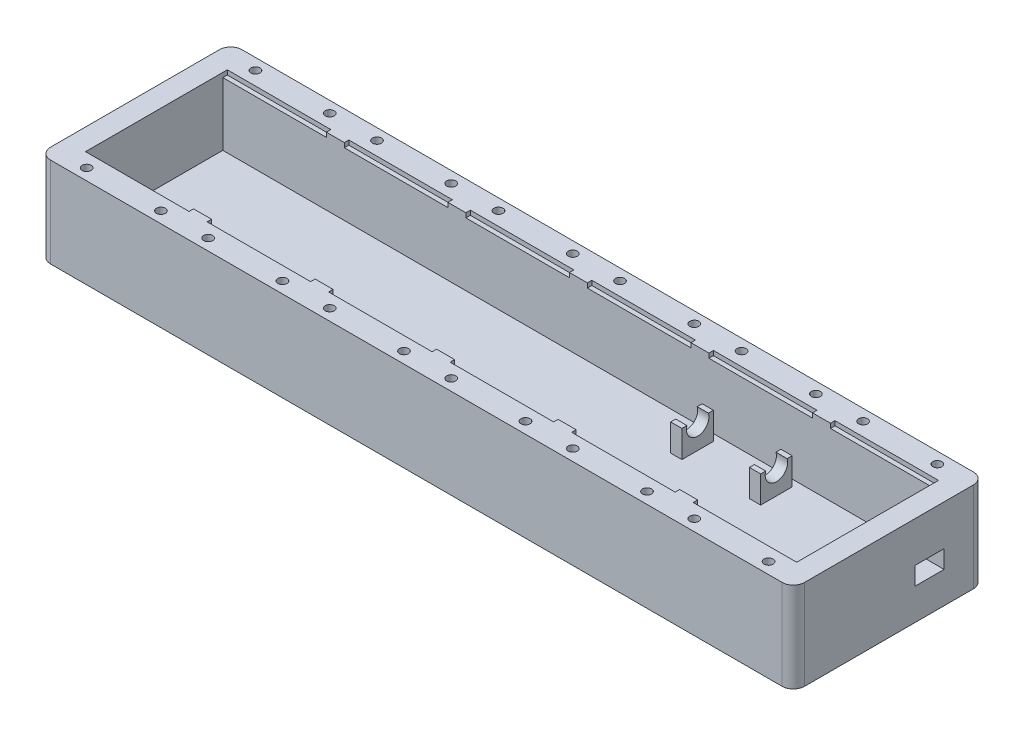
from build123d import *

# Parameters (mm, degrees)
SKIZZE2_W                       = 335
SKIZZE2_H                       = 40
AUFSATZ_LINEAR_AUSTRAGEN1_DEPTH = 85
SKIZZE4_W                       = 316
SKIZZE4_H                       = 59
SCHNITT_LINEAR_AUSTRAGEN1_DEPTH = 30
SKIZZE11_W                      = 46
SKIZZE11_H                      = 2
SCHNITT_LINEAR_AUSTRAGEN4_DEPTH = 2
SKIZZE17_R                      = 2
SCHNITT_LINEAR_AUSTRAGEN6_DEPTH = 4
VERRUNDUNG2_R                   = 5
VERRUNDUNG3_R                   = 5
VERRUNDUNG4_R                   = 5
VERRUNDUNG6_R                   = 5
SKIZZE18_W                      = 13
SKIZZE18_H                      = 8
SCHNITT_LINEAR_AUSTRAGEN7_DEPTH = 10
SKIZZE20_W                      = 5
SKIZZE20_H                      = 14
AUFSATZ_LINEAR_AUSTRAGEN2_DEPTH = 12
SKIZZE21_R                      = 5
SCHNITT_LINEAR_AUSTRAGEN8_DEPTH = 71
SKIZZE22_W                      = 50
SKIZZE22_H                      = 7
AUFSATZ_LINEAR_AUSTRAGEN3_DEPTH = 7


with BuildPart() as part:
    # Skizze2 → Aufsatz-Linear austragen1 (new body)
    with BuildSketch(Plane.XY):
        with Locations((167.5, 20)):
            Rectangle(SKIZZE2_W, SKIZZE2_H)
    extrude(amount=AUFSATZ_LINEAR_AUSTRAGEN1_DEPTH)

    # Skizze4 → Schnitt-Linear austragen1 (cut)
    with BuildSketch(Plane(origin=(0, 40, 0), x_dir=(1, 0, 0), z_dir=(0, 1, 0))):
        with Locations((167.5, -42.5)):
            Rectangle(SKIZZE4_W, SKIZZE4_H)
    extrude(amount=-SCHNITT_LINEAR_AUSTRAGEN1_DEPTH, mode=Mode.SUBTRACT)

    # Skizze11 → Schnitt-Linear austragen4 (cut)
    with BuildSketch(Plane(origin=(0, 40, 0), x_dir=(1, 0, 0), z_dir=(0, 1, 0))):
        with Locations((32.5, -12)):
            Rectangle(SKIZZE11_W, SKIZZE11_H)
        with Locations((32.5, -73)):
            Rectangle(SKIZZE11_W, SKIZZE11_H)
        with Locations((86.5, -73)):
            Rectangle(SKIZZE11_W, SKIZZE11_H)
        with Locations((140.5, -73)):
            Rectangle(SKIZZE11_W, SKIZZE11_H)
        with Locations((194.5, -73)):
            Rectangle(SKIZZE11_W, SKIZZE11_H)
        with Locations((248.5, -73)):
            Rectangle(SKIZZE11_W, SKIZZE11_H)
        with Locations((302.5, -73)):
            Rectangle(SKIZZE11_W, SKIZZE11_H)
        with Locations((302.5, -12)):
            Rectangle(SKIZZE11_W, SKIZZE11_H)
        with Locations((248.5, -12)):
            Rectangle(SKIZZE11_W, SKIZZE11_H)
        with Locations((194.5, -12)):
            Rectangle(SKIZZE11_W, SKIZZE11_H)
        with Locations((140.5, -12)):
            Rectangle(SKIZZE11_W, SKIZZE11_H)
        with Locations((86.5, -12)):
            Rectangle(SKIZZE11_W, SKIZZE11_H)
    extrude(amount=-SCHNITT_LINEAR_AUSTRAGEN4_DEPTH, mode=Mode.SUBTRACT)

    # Skizze17 → Schnitt-Linear austragen6 (cut)
    with BuildSketch(Plane(origin=(0, 40, 0), x_dir=(1, 0, 0), z_dir=(0, 1, 0))):
        with Locations((49, -80)):
            Circle(SKIZZE17_R)
        with Locations((16, -80)):
            Circle(SKIZZE17_R)
        with Locations((16, -5)):
            Circle(SKIZZE17_R)
        with Locations((49, -5)):
            Circle(SKIZZE17_R)
        with Locations((70, -5)):
            Circle(SKIZZE17_R)
        with Locations((103, -5)):
            Circle(SKIZZE17_R)
        with Locations((70, -80)):
            Circle(SKIZZE17_R)
        with Locations((103, -80)):
            Circle(SKIZZE17_R)
        with Locations((124, -80)):
            Circle(SKIZZE17_R)
        with Locations((157, -80)):
            Circle(SKIZZE17_R)
        with Locations((178, -80)):
            Circle(SKIZZE17_R)
        with Locations((211, -80)):
            Circle(SKIZZE17_R)
        with Locations((232, -80)):
            Circle(SKIZZE17_R)
        with Locations((265, -80)):
            Circle(SKIZZE17_R)
        with Locations((286, -80)):
            Circle(SKIZZE17_R)
        with Locations((319, -80)):
            Circle(SKIZZE17_R)
        with Locations((319, -5)):
            Circle(SKIZZE17_R)
        with Locations((286, -5)):
            Circle(SKIZZE17_R)
        with Locations((265, -5)):
            Circle(SKIZZE17_R)
        with Locations((232, -5)):
            Circle(SKIZZE17_R)
        with Locations((211, -5)):
            Circle(SKIZZE17_R)
        with Locations((178, -5)):
            Circle(SKIZZE17_R)
        with Locations((157, -5)):
            Circle(SKIZZE17_R)
        with Locations((124, -5)):
            Circle(SKIZZE17_R)
    extrude(amount=-SCHNITT_LINEAR_AUSTRAGEN6_DEPTH, mode=Mode.SUBTRACT)

    # Verrundung2
    verrundung2_edges = [part.edges().sort_by_distance(p)[0] for p in [
        (0, 20, 85),
    ]]
    fillet(verrundung2_edges, radius=VERRUNDUNG2_R)

    # Verrundung3
    verrundung3_edges = [part.edges().sort_by_distance(p)[0] for p in [
        (0, 20, 0),
    ]]
    fillet(verrundung3_edges, radius=VERRUNDUNG3_R)

    # Verrundung4
    verrundung4_edges = [part.edges().sort_by_distance(p)[0] for p in [
        (335, 20, 0),
    ]]
    fillet(verrundung4_edges, radius=VERRUNDUNG4_R)

    # Verrundung6
    verrundung6_edges = [part.edges().sort_by_distance(p)[0] for p in [
        (335, 20, 85),
    ]]
    fillet(verrundung6_edges, radius=VERRUNDUNG6_R)

    # Skizze18 → Schnitt-Linear austragen7 (cut)
    with BuildSketch(Plane.ZY.offset(-325.5)):
        with Locations((24.5, 18)):
            Rectangle(SKIZZE18_W, SKIZZE18_H)
    extrude(amount=-SCHNITT_LINEAR_AUSTRAGEN7_DEPTH, mode=Mode.SUBTRACT)

    # Skizze20 → Aufsatz-Linear austragen2 (add)
    with BuildSketch(Plane(origin=(0, 10, 0), x_dir=(1, 0, 0), z_dir=(0, 1, 0))):
        with Locations((263, -23)):
            Rectangle(SKIZZE20_W, SKIZZE20_H)
        with Locations((228, -23)):
            Rectangle(SKIZZE20_W, SKIZZE20_H)
    extrude(amount=AUFSATZ_LINEAR_AUSTRAGEN2_DEPTH)

    # Skizze21 → Schnitt-Linear austragen8 (cut)
    with BuildSketch(Plane.ZY.offset(-225.5)):
        with Locations((23, 20.5)):
            Circle(SKIZZE21_R)
    extrude(amount=-SCHNITT_LINEAR_AUSTRAGEN8_DEPTH, mode=Mode.SUBTRACT)

    # Skizze22 → Aufsatz-Linear austragen3 (add)
    with BuildSketch(Plane(origin=(0, 0, 72), x_dir=(-1, 0, 0), z_dir=(0, 0, -1))):
        with Locations((-300.5, 13.5)):
            Rectangle(SKIZZE22_W, SKIZZE22_H)
    extrude(amount=AUFSATZ_LINEAR_AUSTRAGEN3_DEPTH)


solid = part.part
